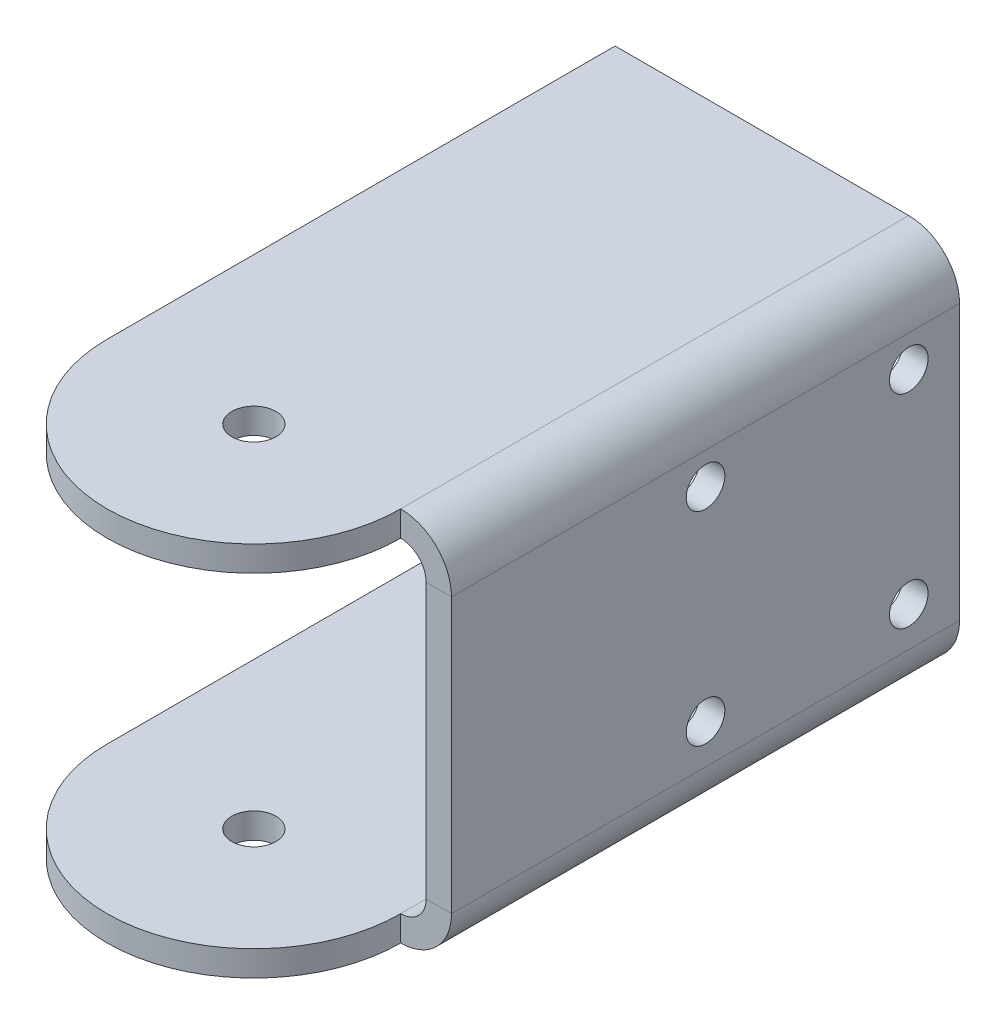
from build123d import *

# Parameters (mm, degrees)
BASE_FLANGE1_DEPTH      = 63.5
BOSS_EXTRUDE1_DEPTH     = 3.175
BOSS_EXTRUDE2_START     = -3.175
BOSS_EXTRUDE2_DEPTH     = 3.175
SKETCH8_R               = 2.413
CUT_EXTRUDE1_DEPTH      = 3.175
CUT_EXTRUDE2_DEPTH      = 103.459665412
CUT_EXTRUDE2_DEPTH_BACK = 103.459665412
SKETCH10_R              = 2.753999953


# Sheet-metal steps are written as plain solids
with BuildPart() as part:
    # Sketch1 → Base-Flange1 (new body)
    with BuildSketch(Plane.XY):
        with BuildLine():
            Line((-39.878, -20.32), (-3.175, -20.32))
            ThreePointArc((-3.175, -20.32), (-0.92993597, -19.39006403), (0, -17.145))
            Line((0, -17.145), (0, 17.145))
            ThreePointArc((0, 17.145), (-0.92993597, 19.39006403), (-3.175, 20.32))
            Line((-3.175, 20.32), (-39.878, 20.32))
            Line((-39.878, 20.32), (-39.878, 23.495))
            Line((-39.878, 23.495), (-3.175, 23.495))
            ThreePointArc((-3.175, 23.495), (1.315128061, 21.635128061), (3.175, 17.145))
            Line((3.175, 17.145), (3.175, -17.145))
            ThreePointArc((3.175, -17.145), (1.315128061, -21.635128061), (-3.175, -23.495))
            Line((-3.175, -23.495), (-39.878, -23.495))
            Line((-39.878, -23.495), (-39.878, -20.32))
        make_face()
    extrude(amount=BASE_FLANGE1_DEPTH)

    # Sketch6 → Boss-Extrude1 (add)
    with BuildSketch(Plane(origin=(0, 23.495, 0), x_dir=(1, 0, 0), z_dir=(0, 1, 0))):
        with BuildLine():
            Line((-39.878, -63.5), (-3.175, -63.5))
            ThreePointArc((-3.175, -63.5), (-21.5265, -81.8515), (-39.878, -63.5))
        make_face()
    extrude(amount=-BOSS_EXTRUDE1_DEPTH)

    # Sketch7 → Boss-Extrude2 (add)
    with BuildSketch(Plane.XZ.offset(23.495).offset(BOSS_EXTRUDE2_START)):
        with BuildLine():
            Line((-3.175, 63.5), (-39.878, 63.5))
            ThreePointArc((-39.878, 63.5), (-21.5265, 81.8515), (-3.175, 63.5))
        make_face()
    extrude(amount=BOSS_EXTRUDE2_DEPTH)

    # Sketch8 → Cut-Extrude1 (cut)
    with BuildSketch(Plane(origin=(3.175, 0, 0), x_dir=(0, 0, -1), z_dir=(1, 0, 0))):
        with Locations(Location((-6.35, 13.18662794, 0), (0, 0, 90))):
            Circle(SKETCH8_R)
        with Locations(Location((-31.75, 13.18662794, 0), (0, 0, 90))):
            Circle(SKETCH8_R)
        with Locations(Location((-31.75, -12.21337206, 0), (0, 0, 90))):
            Circle(SKETCH8_R)
        with Locations(Location((-6.35, -12.21337206, 0), (0, 0, 90))):
            Circle(SKETCH8_R)
    extrude(amount=-CUT_EXTRUDE1_DEPTH, mode=Mode.SUBTRACT)

    # Sketch10 → Cut-Extrude2 (cut, two sides: drawn at the far end of the back side and taken through both)
    with BuildSketch(Plane(origin=(0, 23.495, 0), x_dir=(1, 0, 0), z_dir=(0, 1, 0)).offset(-CUT_EXTRUDE2_DEPTH_BACK)):
        with Locations(Location((-21.5265, -63.5, 0), (0, 0, 180))):
            Circle(SKETCH10_R)
    extrude(amount=CUT_EXTRUDE2_DEPTH + CUT_EXTRUDE2_DEPTH_BACK, mode=Mode.SUBTRACT)


solid = part.part
